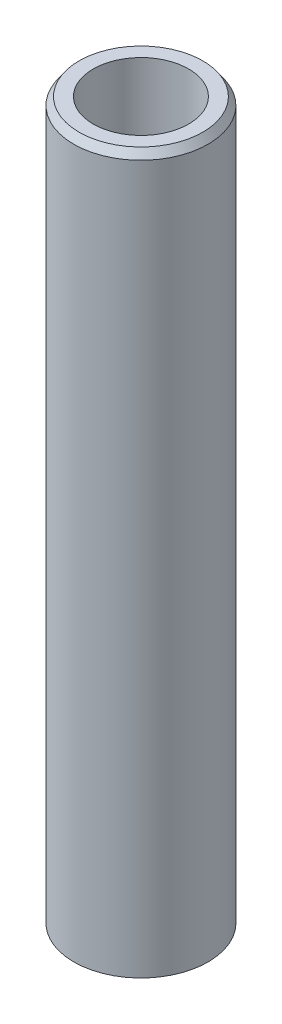
from build123d import *
from OCP.BRepFilletAPI import BRepFilletAPI_MakeChamfer

# Parameters (mm, degrees)
SKETCH1_R           = 50
BOSS_EXTRUDE1_DEPTH = 536.812885719
SKETCH2_R           = 35.533858966
CUT_EXTRUDE1_DEPTH  = 542.449973935
CHAMFER1_SIZE       = 5.771371554
CHAMFER1_SIZE2      = 3.960686789


with BuildPart() as part:
    # Sketch1 → Boss-Extrude1 (new body)
    with BuildSketch(Plane(origin=(0, 0, 0), x_dir=(1, 0, 0), z_dir=(0, 1, 0))):
        Circle(SKETCH1_R)
    extrude(amount=BOSS_EXTRUDE1_DEPTH)

    # Sketch2 → Cut-Extrude1 (cut, through all)
    with BuildSketch(Plane(origin=(0, 0, 0), x_dir=(1, 0, 0), z_dir=(0, 1, 0))):
        Circle(SKETCH2_R)
    extrude(amount=CUT_EXTRUDE1_DEPTH, mode=Mode.SUBTRACT)

    # Chamfer1: one chamfer whose edges measure the first distance from different faces: ONE call of the kernel's chamfer builder (chamfer() names one face for all edges)
    chamfer1_edges_1 = [part.edges().sort_by_distance(p)[0] for p in [
        (-50, 536.812885719, 0),
    ]]
    chamfer1_side_1 = [part.faces().sort_by_distance(p)[0] for p in [
        (-50, 268.40644286, 0),
    ]]
    chamfer1_edges_2 = [part.edges().sort_by_distance(p)[0] for p in [
        (-50, 0, 0),
    ]]
    chamfer1_side_2 = [part.faces().sort_by_distance(p)[0] for p in [
        (-48.585786438, 0, 0),
    ]]
    chamfer1 = BRepFilletAPI_MakeChamfer(part.part.solid().wrapped)
    for e in chamfer1_edges_1:
        chamfer1.Add(CHAMFER1_SIZE, CHAMFER1_SIZE2, e.wrapped, chamfer1_side_1[0].wrapped)  # the first distance lies on this face
    for e in chamfer1_edges_2:
        chamfer1.Add(CHAMFER1_SIZE, CHAMFER1_SIZE2, e.wrapped, chamfer1_side_2[0].wrapped)  # the first distance lies on this face
    add(Compound.cast(chamfer1.Shape()), mode=Mode.REPLACE)


solid = part.part
